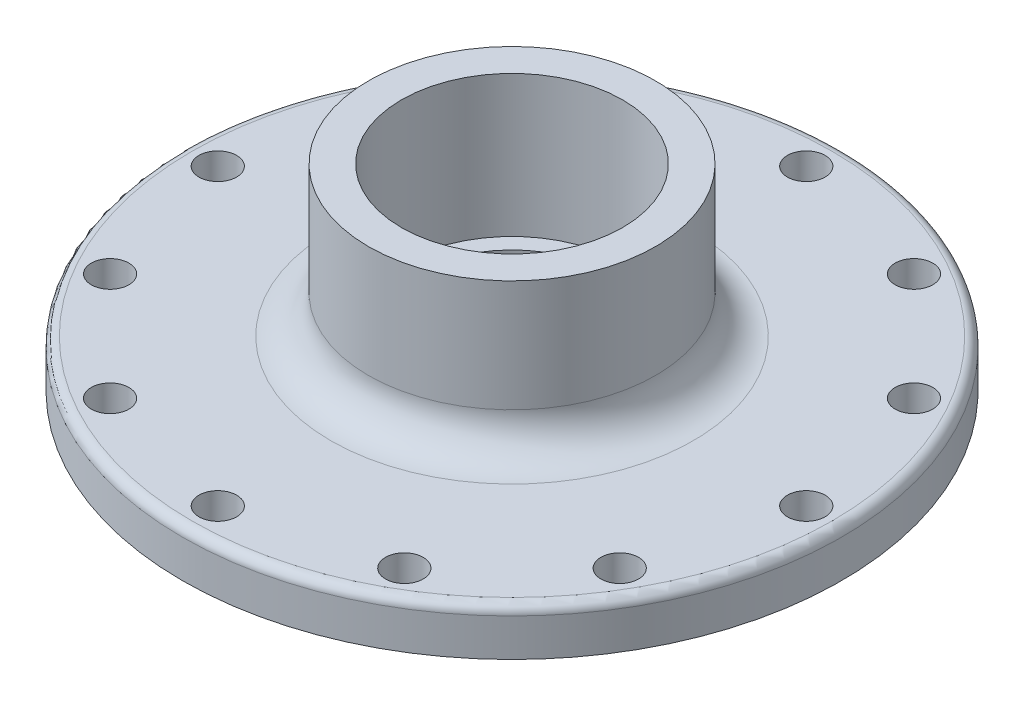
from build123d import *

# Parameters (mm, degrees)
F_8_0MM_DOWEL_HOLE2_D = 8
F_8_0MM_DOWEL_HOLE1_D = 8


with BuildPart() as part:
    # Sketch1 → Revolve1 (revolve)
    with BuildSketch(Plane.XY):
        with BuildLine():
            Line((-70, -26.698290186), (-45, -26.698290186))
            Line((-45, -26.698290186), (-45, -31.698290186))
            Line((-45, -31.698290186), (-40, -31.698290186))
            Line((-40, -31.698290186), (-40, -26.698290186))
            Line((-40, -26.698290186), (-20, -26.698290186))
            Line((-20, -26.698290186), (-20, -14.981775429))
            Line((-20, -14.981775429), (-23.5, -14.981775429))
            Line((-23.5, -14.981775429), (-23.5, 15.018224571))
            Line((-23.5, 15.018224571), (-30.5, 15.018224571))
            Line((-30.5, 15.018224571), (-30.5, -8.698290186))
            ThreePointArc((-30.5, -8.698290186), (-32.843145751, -14.355144435), (-38.5, -16.698290186))
            Line((-38.5, -16.698290186), (-68, -16.698290186))
            ThreePointArc((-68, -16.698290186), (-69.414213562, -17.284076623), (-70, -18.698290186))
            Line((-70, -18.698290186), (-70, -26.698290186))
        make_face()
    revolve(axis=Axis((0, 95.786399453, 0), (0, -1, 0)))

    # Ø8.0mm Dowel Hole2 (through all)
    with Locations(Plane(origin=(0, -16.698290186, 0), x_dir=(1, 0, 0), z_dir=(0, 1, 0))):
        with Locations((-31.25, 54.126587737), (0, 62.5), (31.25, 54.126587737), (54.126587737, 31.25), (62.5, 0), (54.126587737, -31.25), (31.25, -54.126587737), (0, -62.5), (-31.25, -54.126587737), (-54.126587737, -31.25), (-62.5, 0), (-54.126587737, 31.25)):
            Hole(F_8_0MM_DOWEL_HOLE2_D / 2)

    # Ø8.0mm Dowel Hole1 (through all)
    with Locations(Plane(origin=(0, -16.698290186, 0), x_dir=(1, 0, 0), z_dir=(0, 1, 0))):
        with Locations((0, 0), (31.25, -54.126587737), (0, -62.5), (-31.25, -54.126587737), (-54.126587737, -31.25), (-62.5, 0), (-54.126587737, 31.25), (-31.25, 54.126587737), (0, 62.5), (31.25, 54.126587737), (54.126587737, 31.25), (62.5, 0), (54.126587737, -31.25)):
            Hole(F_8_0MM_DOWEL_HOLE1_D / 2)


solid = part.part
